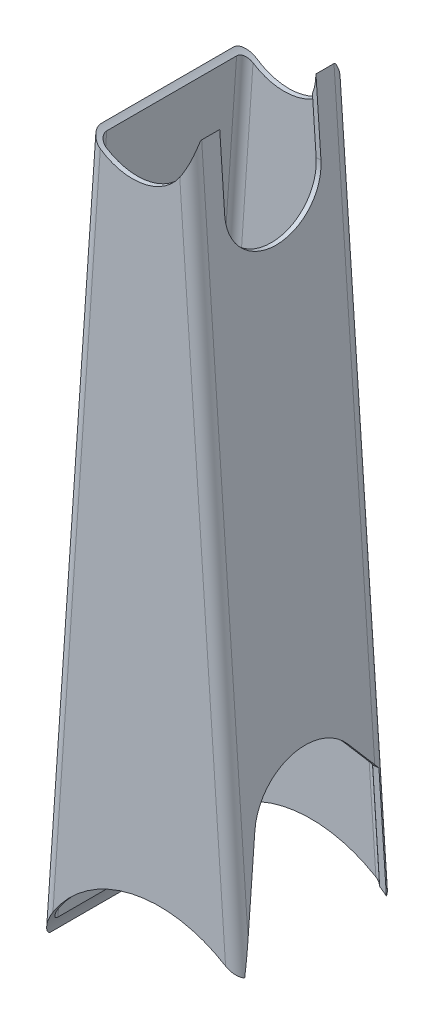
from build123d import *

# Parameters (mm, degrees)
EXTRUDE_1_DEPTH     = 65
SHELL_1_T           = -4
CUT_EXTRUDE_1_REACH = 686.315
CUT_EXTRUDE_2_REACH = 686.315
FILLET_2_R          = 10
FILLET_3_R          = 7


with BuildPart() as part:
    # 草图1 → 凸台-拉伸1 (new, symmetric)
    with BuildSketch(Plane.XY):
        with BuildLine():
            Line((-58.512960007, 634.252160061), (-100.209989819, 31.352160061))
            ThreePointArc((-100.209989819, 31.352160061), (-30.672049595, 100.420243844), (65.590010181, 81.993600753))
            Line((65.590010181, 81.993600753), (25.187039993, 664.293600753))
            ThreePointArc((25.187039993, 664.293600753), (-6.261361418, 620.292452643), (-58.512960007, 634.252160061))
        make_face()
    extrude(amount=EXTRUDE_1_DEPTH, both=True)

    # 抽壳1
    shell_1_openings = [part.faces().sort_by_distance(p)[0] for p in [
        (-30.672049595, 100.420243844, 0),
        (-6.261361418, 620.292452643, 0),
    ]]
    offset(amount=SHELL_1_T, openings=shell_1_openings, kind=Kind.INTERSECTION)

    # 草图2 → 切除-拉伸1 (cut, up to next)
    with BuildSketch(Plane(origin=(70.93763316, 4.922017994, 0), x_dir=(0, 0, -1), z_dir=(0.9976015076237793, 0.06921872569444461, 0)), mode=Mode.PRIVATE) as cut_extrude_1_sk1:
        with BuildLine():
            Line((-40, 660.956882804), (-40, 600.956882804))
            ThreePointArc((-40, 600.956882804), (0, 560.956882804), (40, 600.956882804))
            Line((40, 600.956882804), (40, 660.956882804))
            Line((40, 660.956882804), (-40, 660.956882804))
        make_face()
    cut_extrude_1_tool1 = extrude(cut_extrude_1_sk1.sketch, amount=-CUT_EXTRUDE_1_REACH, mode=Mode.PRIVATE) & part.part
    add(cut_extrude_1_tool1.solids().sort_by_distance((28.381063, 618.26036, 0))[0], mode=Mode.SUBTRACT)

    # 草图3 → 切除-拉伸2 (cut, up to next)
    with BuildSketch(Plane(origin=(70.93763316, 4.922017994, 0), x_dir=(0, 0, -1), z_dir=(0.9976015076237793, 0.06921872569444461, 0)), mode=Mode.PRIVATE) as cut_extrude_2_sk1:
        with BuildLine():
            Line((-58.950365875, 77.256882804), (-44.505713851, 173.908306305))
            ThreePointArc((-44.505713851, 173.908306305), (-12.328164841, 210.535241733), (34.320074836, 196.362422882))
            Line((34.320074836, 196.362422882), (59.003367844, 167.256882804))
            Line((59.003367844, 167.256882804), (59.003367844, 77.256882804))
            Line((59.003367844, 77.256882804), (-58.950365875, 77.256882804))
        make_face()
    cut_extrude_2_tool1 = extrude(cut_extrude_2_sk1.sketch, amount=-CUT_EXTRUDE_2_REACH, mode=Mode.PRIVATE) & part.part
    add(cut_extrude_2_tool1.solids().sort_by_distance((61.423964, 142.035935, -3.018476))[0], mode=Mode.SUBTRACT)

    # 圆角2
    fillet_2_edges = [part.edges().sort_by_distance(p)[0] for p in [
        (45.388525087, 373.143600753, -65),
        (45.388525087, 373.143600753, 65),
        (-79.361474913, 332.802160061, 65),
        (-79.361474913, 332.802160061, -65),
    ]]
    fillet(fillet_2_edges, radius=FILLET_2_R)

    # 圆角3
    # the kernel refuses this fillet: 7 mm, written as the material it adds along each edge
    with BuildSketch(Plane(origin=(-53.567364395, 647.786430481, 61), x_dir=(0, 0, -1), z_dir=(-0.06899595830556898, -0.9976169393797883, 0))) as fillet_3_piece_1_section:
        with BuildLine():
            CenterArc((FILLET_3_R, FILLET_3_R), FILLET_3_R, 180, 90)
            Line((0, FILLET_3_R), (0, 0))
            Line((0, 0), (FILLET_3_R, 0))
        make_face()
    fillet_3_piece_1 = extrude(amount=622.701795047, mode=Mode.PRIVATE)
    fillet_3_piece_1 = fillet_3_piece_1 - Plane(origin=(-22.307707086, 665, 59.408269391), x_dir=(0.9998894121907572, -0.014871563092767819, 0), z_dir=(0, 0, 1)) * Cylinder(47.5, 1274, mode=Mode.PRIVATE)
    fillet_3_piece_1 = fillet_3_piece_1 - Plane(origin=(0, 0, 59.408269391), x_dir=(-0.9543808554191496, 0.29859200057840163, 0), z_dir=(0, 0, 1)) * Cylinder(105, 1274, mode=Mode.PRIVATE)
    add(fillet_3_piece_1)
    with BuildSketch(Plane(origin=(21.055790856, 666.046599906, -61), x_dir=(0, 0, 1), z_dir=(0.06921872569444461, -0.9976015076237793, 0))) as fillet_3_piece_2_section:
        with BuildLine():
            CenterArc((FILLET_3_R, FILLET_3_R), FILLET_3_R, 180, 90)
            Line((0, FILLET_3_R), (0, 0))
            Line((0, 0), (FILLET_3_R, 0))
        make_face()
    fillet_3_piece_2 = extrude(amount=599.735885548, mode=Mode.PRIVATE)
    fillet_3_piece_2 = fillet_3_piece_2 - Plane(origin=(-22.307707086, 665, -57.567140741), x_dir=(0.9998894121907572, -0.014871563092767819, 0), z_dir=(0, 0, 1)) * Cylinder(47.5, 1228, mode=Mode.PRIVATE)
    fillet_3_piece_2 = split(fillet_3_piece_2, bisect_by=Plane(origin=(45.190808802, 311.119705723, 59.715559847), z_dir=(-0.04476996432990456, 0.6452384591552827, -0.7626683296956915)), keep=Keep.TOP, mode=Mode.PRIVATE)
    fillet_3_piece_2 = split(fillet_3_piece_2, bisect_by=Plane(origin=(38.306109231, 410.34410782, -59.003367844), z_dir=(0, 0, 1)), keep=Keep.TOP, mode=Mode.PRIVATE)
    add(fillet_3_piece_2)
    with BuildSketch(Plane(origin=(21.055790856, 666.046599906, -61), x_dir=(0, 0, 1), z_dir=(0.06921872569444461, -0.9976015076237793, 0))) as fillet_3_piece_3_section:
        with BuildLine():
            CenterArc((FILLET_3_R, FILLET_3_R), FILLET_3_R, 180, 90)
            Line((0, FILLET_3_R), (0, 0))
            Line((0, 0), (FILLET_3_R, 0))
        make_face()
    fillet_3_piece_3 = extrude(amount=599.735885548, mode=Mode.PRIVATE)
    fillet_3_piece_3 = fillet_3_piece_3 - Plane(origin=(-22.307707086, 665, -60.275474349), x_dir=(0.9998894121907572, -0.014871563092767819, 0), z_dir=(0, 0, 1)) * Cylinder(47.5, 1228, mode=Mode.PRIVATE)
    fillet_3_piece_3 = split(fillet_3_piece_3, bisect_by=Plane(origin=(43.813424167, 307.914474781, 57.084700881), z_dir=(-0.04476996432990456, 0.6452384591552827, -0.7626683296956915)), keep=Keep.TOP, mode=Mode.PRIVATE)
    fillet_3_piece_3 = split(fillet_3_piece_3, bisect_by=Plane(origin=(36.9241767, 407.204422564, -59.003367844), z_dir=(0, 0, -1)), keep=Keep.TOP, mode=Mode.PRIVATE)
    add(fillet_3_piece_3)
    with BuildSketch(Plane(origin=(21.055790856, 666.046599906, -61), x_dir=(0, 0, 1), z_dir=(0.06921872569444461, -0.9976015076237793, 0))) as fillet_3_piece_4_section:
        with BuildLine():
            CenterArc((FILLET_3_R, FILLET_3_R), FILLET_3_R, 180, 90)
            Line((0, FILLET_3_R), (0, 0))
            Line((0, 0), (FILLET_3_R, 0))
        make_face()
    fillet_3_piece_4 = extrude(amount=599.735885548, mode=Mode.PRIVATE)
    fillet_3_piece_4 = split(fillet_3_piece_4, bisect_by=Plane(origin=(55.090839822, 145.685566131, -80.827437921), z_dir=(0.04476996432990456, -0.6452384591552827, 0.7626683296956915)), keep=Keep.TOP, mode=Mode.PRIVATE)
    fillet_3_piece_4 = fillet_3_piece_4 - Plane(origin=(0, 0, -60.266827154), x_dir=(-0.9543808554191496, 0.29859200057840163, 0), z_dir=(0, 0, 1)) * Cylinder(105, 1228, mode=Mode.PRIVATE)
    fillet_3_piece_4 = split(fillet_3_piece_4, bisect_by=Plane(origin=(56.29778362, 128.290721879, -59.003367844), z_dir=(0, 0, -1)), keep=Keep.TOP, mode=Mode.PRIVATE)
    add(fillet_3_piece_4)
    with BuildSketch(Plane(origin=(-96.531271483, 26.56857156, -61), x_dir=(0.9976169393797882, -0.06899595830556898, 0), z_dir=(0.06899595830556898, 0.9976169393797883, 0))) as fillet_3_piece_5_section:
        with BuildLine():
            CenterArc((FILLET_3_R, -FILLET_3_R), FILLET_3_R, 90, 90)
            Line((0, -FILLET_3_R), (0, 0))
            Line((0, 0), (FILLET_3_R, 0))
        make_face()
    fillet_3_piece_5 = extrude(amount=622.701795047, mode=Mode.PRIVATE)
    fillet_3_piece_5 = fillet_3_piece_5 - Plane(origin=(-22.307707086, 665, -59.408268286), x_dir=(0.9998894121907572, -0.014871563092767819, 0), z_dir=(0, 0, 1)) * Cylinder(47.5, 1274, mode=Mode.PRIVATE)
    fillet_3_piece_5 = fillet_3_piece_5 - Plane(origin=(0, 0, -59.408268286), x_dir=(-0.9543808554191496, 0.29859200057840163, 0), z_dir=(0, 0, 1)) * Cylinder(105, 1274, mode=Mode.PRIVATE)
    add(fillet_3_piece_5)
    with BuildSketch(Plane(origin=(21.055790856, 666.046599906, 61), x_dir=(0, 0, -1), z_dir=(0.06921872569444461, -0.9976015076237793, 0))) as fillet_3_piece_6_section:
        with BuildLine():
            CenterArc((FILLET_3_R, -FILLET_3_R), FILLET_3_R, 90, 90)
            Line((0, -FILLET_3_R), (0, 0))
            Line((0, 0), (FILLET_3_R, 0))
        make_face()
    fillet_3_piece_6 = extrude(amount=599.735885548, mode=Mode.PRIVATE)
    fillet_3_piece_6 = fillet_3_piece_6 - Plane(origin=(-22.307707086, 665, 59.420291377), x_dir=(0.9998894121907572, -0.014871563092767819, 0), z_dir=(0, 0, 1)) * Cylinder(47.5, 1228, mode=Mode.PRIVATE)
    fillet_3_piece_6 = split(fillet_3_piece_6, bisect_by=Plane(origin=(40.666871165, 360.585918915, 17.156503264), z_dir=(-0.010231179084037917, 0.1474548913838828, 0.9890158633619169)), keep=Keep.TOP, mode=Mode.PRIVATE)
    fillet_3_piece_6 = fillet_3_piece_6 - Plane(origin=(0, 0, 59.420291377), x_dir=(-0.9543808554191496, 0.29859200057840163, 0), z_dir=(0, 0, 1)) * Cylinder(105, 1228, mode=Mode.PRIVATE)
    add(fillet_3_piece_6)


solid = part.part
